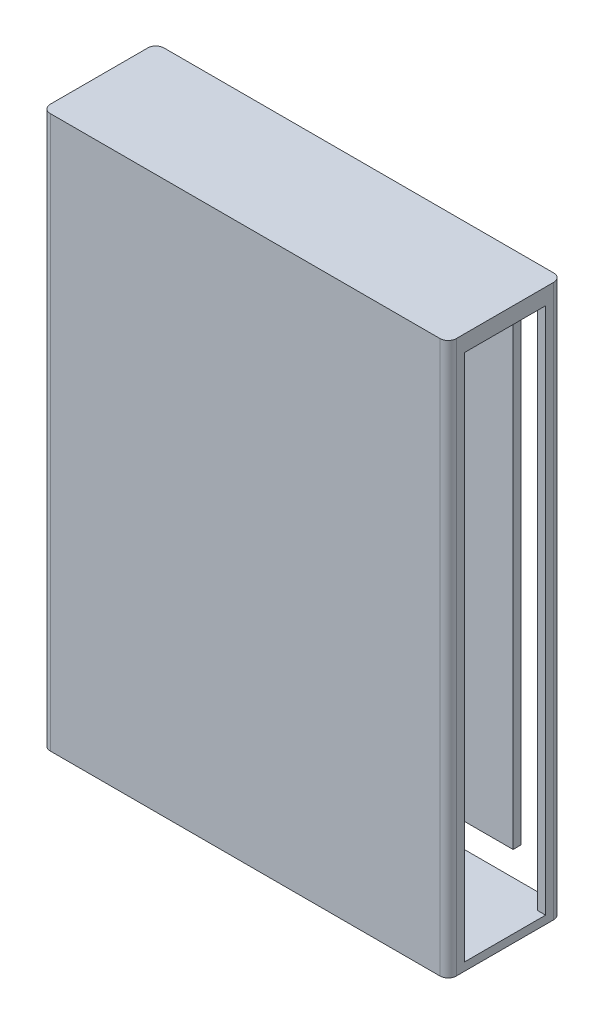
from build123d import *

# Parameters (mm, degrees)
SKETCH_2_W          = 250
SKETCH_2_H          = 70
EXTRUDE_1_DEPTH     = 340
CUT_EXTRUDE_START   = -5
SKETCH_3_W          = 60
SKETCH_3_H          = 330
CUT_EXTRUDE_1_DEPTH = 240
SKETCH_4_W          = 50
SKETCH_4_H          = 325
CUT_EXTRUDE_2_DEPTH = 5
CUT_EXTRUDE_3_DEPTH = 5
FILLET_START        = -1
FILLET_1_DEPTH      = 342
SKETCH_6_W          = 13
SKETCH_6_H          = 4
CUT_EXTRUDE_4_DEPTH = 10


with BuildPart() as part:
    # 草圖2 → 填料-伸長1 (new body)
    with BuildSketch(Plane(origin=(0, 0, 0), x_dir=(1, 0, 0), z_dir=(0, 1, 0))):
        with Locations((90.582134355, -14.950757877)):
            Rectangle(SKETCH_2_W, SKETCH_2_H)
    extrude(amount=EXTRUDE_1_DEPTH)

    # 草圖3 → 除料-伸長1 (cut)
    with BuildSketch(Plane(origin=(215.582134355, 0, 0), x_dir=(0, 0, -1), z_dir=(1, 0, 0)).offset(CUT_EXTRUDE_START)):
        with Locations((-14.950757877, 170)):
            Rectangle(SKETCH_3_W, SKETCH_3_H)
    extrude(amount=-CUT_EXTRUDE_1_DEPTH, mode=Mode.SUBTRACT)

    # 草圖4 → 除料-伸長2 (cut)
    with BuildSketch(Plane(origin=(215.582134355, 0, 0), x_dir=(0, 0, -1), z_dir=(1, 0, 0))):
        with Locations((-14.950757877, 167.5)):
            Rectangle(SKETCH_4_W, SKETCH_4_H)
    extrude(amount=-CUT_EXTRUDE_2_DEPTH, mode=Mode.SUBTRACT)

    # 草圖5 → 除料-伸長3 (cut)
    with BuildSketch(Plane(origin=(0, 0, -20.049242123), x_dir=(-1, 0, 0), z_dir=(0, 0, -1))):
        Polygon((-210.582134355, 330), (-190.582134355, 330), (-190.582134355, 25), (29.417865645, 25), (29.417865645, 5), (-210.582134355, 5), align=None)
    extrude(amount=-CUT_EXTRUDE_3_DEPTH, mode=Mode.SUBTRACT)

    # 圓角1: read off the stored shape, not the designer's step
    # 圓角1 outline → 圓角1 (cut)
    with BuildSketch(Plane(origin=(0, 0, 0), x_dir=(1, 0, 0), z_dir=(0, 1, 0)).offset(FILLET_START)):
        with BuildLine():
            Line((215.582134355, 20.049242123), (210.582134355, 20.049242123))
            ThreePointArc((210.582134355, 20.049242123), (214.117668261, 18.584776029), (215.582134355, 15.049242123))
            Line((215.582134355, 15.049242123), (215.582134355, 20.049242123))
        make_face()
        with BuildLine():
            ThreePointArc((-34.417865645, 15.049242123), (-32.953399551, 18.584776029), (-29.417865645, 20.049242123))
            Line((-29.417865645, 20.049242123), (-34.417865645, 20.049242123))
            Line((-34.417865645, 20.049242123), (-34.417865645, 15.049242123))
        make_face()
        with BuildLine():
            Line((215.582134355, -49.950757877), (215.582134355, -44.950757877))
            ThreePointArc((215.582134355, -44.950757877), (214.117668261, -48.486291783), (210.582134355, -49.950757877))
            Line((210.582134355, -49.950757877), (215.582134355, -49.950757877))
        make_face()
        with BuildLine():
            ThreePointArc((-29.417865645, -49.950757877), (-32.953399551, -48.486291783), (-34.417865645, -44.950757877))
            Line((-34.417865645, -44.950757877), (-34.417865645, -49.950757877))
            Line((-34.417865645, -49.950757877), (-29.417865645, -49.950757877))
        make_face()
    extrude(amount=FILLET_1_DEPTH, mode=Mode.SUBTRACT)

    # 草圖6 → 除料-伸長4 (cut)
    with BuildSketch(Plane(origin=(0, 0, -20.049242123), x_dir=(-1, 0, 0), z_dir=(0, 0, -1))):
        with Locations((-56.582134355, 27)):
            Rectangle(SKETCH_6_W, SKETCH_6_H)
    extrude(amount=-CUT_EXTRUDE_4_DEPTH, mode=Mode.SUBTRACT)


solid = part.part
